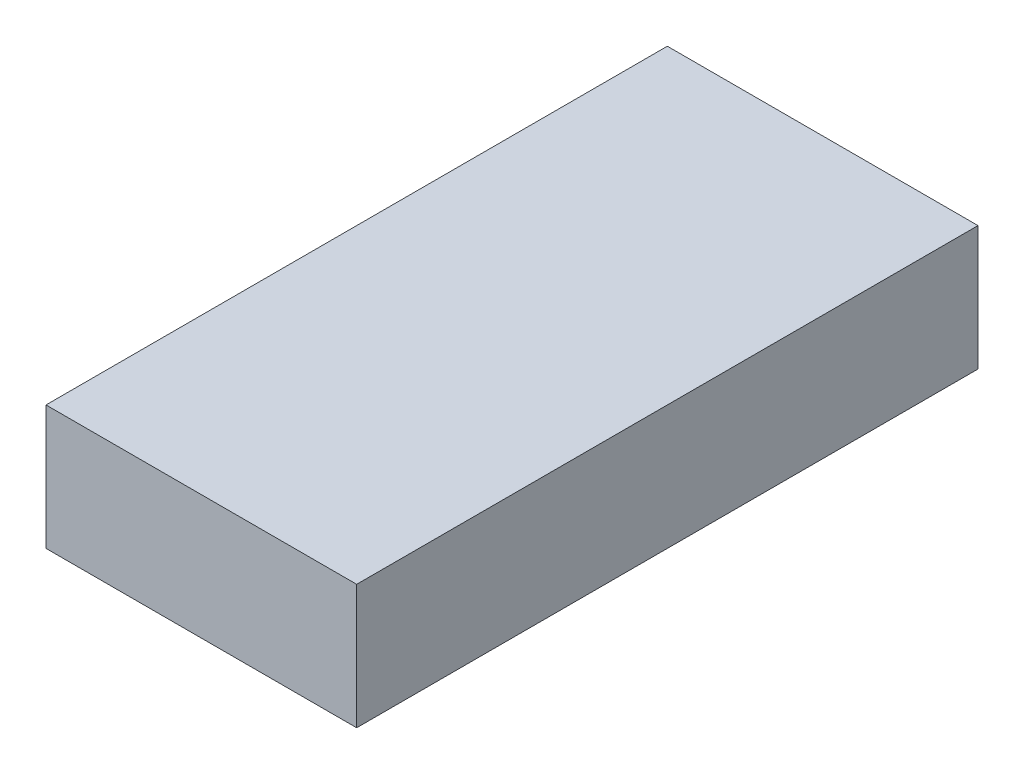
from build123d import *

# Parameters (mm, degrees)
SKETCH_1_W      = 20
SKETCH_1_H      = 4
EXTRUDE_1_DEPTH = 10


with BuildPart() as part:
    # Эскиз1 → Бобышка-Вытянуть1 (new body)
    with BuildSketch(Plane(origin=(0, 0, 0), x_dir=(0, 0, -1), z_dir=(1, 0, 0))):
        with Locations((10, 2)):
            Rectangle(SKETCH_1_W, SKETCH_1_H)
    extrude(amount=EXTRUDE_1_DEPTH)


solid = part.part
